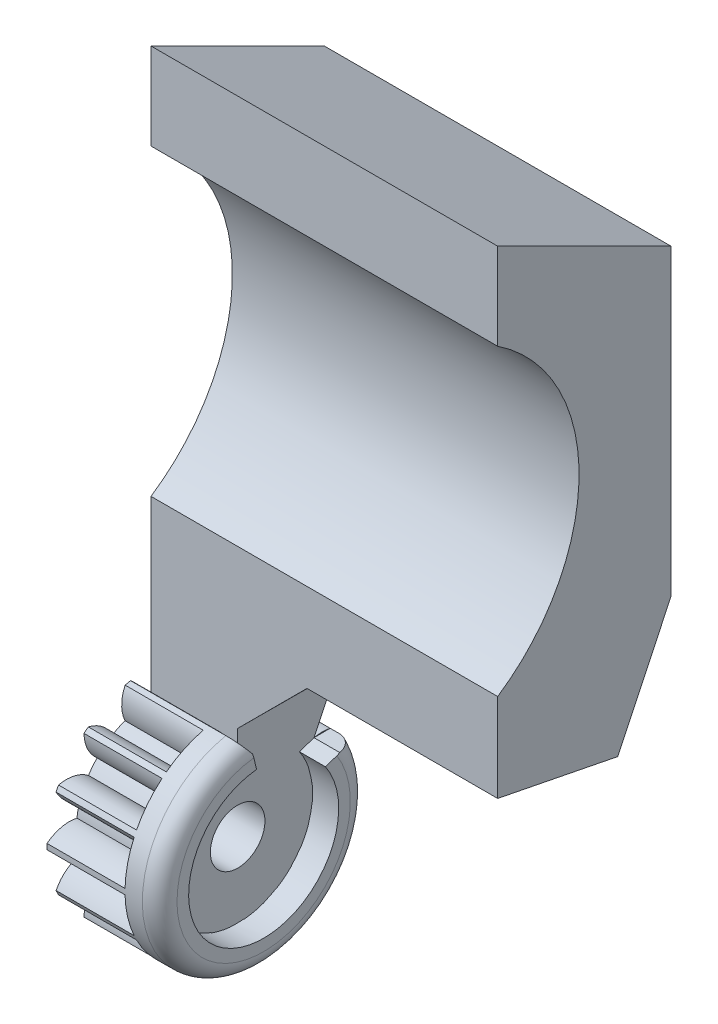
from build123d import *

# Parameters (mm, degrees)
BASPROSKE_W              = 10
BASPROSKE_H              = 12
TOOTHCUT_DEPTH           = 20.697716
TEETHCUTS_COUNT          = 14
TEETHCUTS_ANGLE          = 334.285714
BORSKE_R                 = 1.5
BORE_DEPTH               = 50.000051
BOSS_EXTRUDE1_DEPTH      = 10
BOSS_EXTRUDE2_START      = -40
BOSS_EXTRUDE2_DEPTH      = 40
CUT_EXTRUDE5_DEPTH       = 30
BOSS_EXTRUDE5_DEPTH      = 10
CHAMFER1_SIZE            = 10
BOSS_EXTRUDE6_DEPTH      = 3
BOSS_EXTRUDE6_DEPTH_BACK = 1
FILLET1_R                = 2
SKETCH12_R               = 3.15
CUT_EXTRUDE6_DEPTH       = 87.463865


with BuildPart() as part:
    # BasProSke → Base-Revolve (revolve)
    with BuildSketch(Plane(origin=(0, 0, 0), x_dir=(1, 0, 0), z_dir=(0, 1, 0)), mode=Mode.PRIVATE) as base_revolve_sk:
        with Locations((5, 6)):
            Rectangle(BASPROSKE_W, BASPROSKE_H)
    revolve(base_revolve_sk.sketch.rotate(Axis((-10, 0, 0), (1, 0, 0)), 180), axis=Axis((-10, 0, 0), (1, 0, 0)))

    # TooCutSke → ToothCut (cut, through all)
    with BuildSketch(Plane(origin=(0, 0, 0), x_dir=(0, 0, -1), z_dir=(1, 0, 0))):
        with BuildLine():
            ThreePointArc((0.804846, 8.586361), (0, 8.624), (-0.804846, 8.586361))
            ThreePointArc((-0.804846, 8.586361), (-1.237812, 10.362618), (-2.384428, 11.786634))
            ThreePointArc((-2.384428, 11.786634), (0, 12.0254), (2.384428, 11.786634))
            ThreePointArc((2.384428, 11.786634), (1.237812, 10.362618), (0.804846, 8.586361))
        make_face()
    toothcut = extrude(amount=TOOTHCUT_DEPTH, mode=Mode.SUBTRACT)

    # TeethCuts: ToothCut ×14 about axis
    teethcuts_axis = Axis((-10, 0, 0), (1, 0, 0))
    for i in range(1, TEETHCUTS_COUNT):
        add(toothcut.rotate(teethcuts_axis, i * TEETHCUTS_ANGLE / (TEETHCUTS_COUNT - 1)), mode=Mode.SUBTRACT)

    # BorSke → Bore (cut, symmetric)
    with BuildSketch(Plane(origin=(0, 0, 0), x_dir=(0, 0, -1), z_dir=(1, 0, 0))):
        with Locations(Location((0, 0, 0), (0, 0, 180))):
            Circle(BORSKE_R)
    extrude(amount=BORE_DEPTH, both=True, mode=Mode.SUBTRACT)

    # Sketch1 → Boss-Extrude1 (add)
    with BuildSketch(Plane(origin=(10, 0, 0), x_dir=(0, 0, -1), z_dir=(1, 0, 0))):
        with BuildLine():
            Line((0, 29), (0, 4))
            Line((0, 4), (8, 4))
            Line((8, 4), (20, 29))
            Line((20, 29), (20, 64))
            Line((20, 64), (0, 74))
            Line((0, 74), (0, 64))
            ThreePointArc((0, 64), (9.391813, 46.5), (0, 29))
        make_face()
    extrude(amount=-BOSS_EXTRUDE1_DEPTH)

    # Sketch2 → Boss-Extrude2 (add)
    with BuildSketch(Plane.ZY.offset(BOSS_EXTRUDE2_START)):
        with BuildLine():
            Line((-20, 29), (-7.698792, 3.139406))
            Line((-7.698792, 3.139406), (0, 8.624))
            Line((0, 8.624), (0, 29))
            ThreePointArc((0, 29), (-9.391813, 46.5), (0, 64))
            Line((0, 64), (0, 74))
            Line((0, 74), (-20, 64))
            Line((-20, 64), (-20, 29))
        make_face()
    extrude(amount=BOSS_EXTRUDE2_DEPTH)

    # Sketch9 → Cut-Extrude5 (cut)
    with BuildSketch(Plane(origin=(40, 0, 0), x_dir=(0, 0, -1), z_dir=(1, 0, 0))):
        Polygon((7.698792, 3.139406), (0, 8.624), (0, 18.812), (13.849396, 16.069703), align=None)
    extrude(amount=-CUT_EXTRUDE5_DEPTH, mode=Mode.SUBTRACT)

    # Sketch10 → Boss-Extrude5 (add)
    with BuildSketch(Plane(origin=(10, 0, 0), x_dir=(0, 0, -1), z_dir=(1, 0, 0))):
        Polygon((0, 18.812), (0, 10.812), (11.330599, 10.774484), (15.153835, 18.812), align=None)
    extrude(amount=BOSS_EXTRUDE5_DEPTH)

    # Chamfer1
    # the kernel refuses this chamfer: 10 mm, written as the material it takes off along each edge
    with BuildSketch(Plane(origin=(20, 10.897149, 25.716689), x_dir=(0.027495876610586313, 0.9996164375424699, -0.003309768015556128), z_dir=(0, -0.0033110198561701067, -0.999994518558733))) as chamfer1_piece_1_section:
        Polygon((CHAMFER1_SIZE * 0.999621916911, -CHAMFER1_SIZE * 0.0274958766106), (-CHAMFER1_SIZE * 0.0274958766106, -CHAMFER1_SIZE * 0.999621916911), (0, 0), align=None)
    chamfer1_piece_1 = extrude(amount=62.764321, mode=Mode.PRIVATE)
    chamfer1_piece_1 = split(chamfer1_piece_1, bisect_by=Plane(origin=(16.383831, 18.515288, -1.498481), z_dir=(0, -0.980954576947178, 0.19423727234077168)), keep=Keep.TOP, mode=Mode.PRIVATE)
    chamfer1_piece_1 = split(chamfer1_piece_1, bisect_by=Plane(origin=(10, 13.486301, -0.502699), z_dir=(1, 0, 0)), keep=Keep.TOP, mode=Mode.PRIVATE)
    add(chamfer1_piece_1, mode=Mode.SUBTRACT)

    # Sketch11 → Boss-Extrude6 (add, two sides: drawn at the far end of the back side and taken through both)
    with BuildSketch(Plane(origin=(10, 0, 0), x_dir=(0, 0, -1), z_dir=(1, 0, 0)).offset(-BOSS_EXTRUDE6_DEPTH_BACK)):
        with BuildLine():
            Line((-2.358667, 11.765912), (-1.230525, 10.347781))
            Line((-1.230525, 10.347781), (-0.81596, 8.618917))
            ThreePointArc((-0.81596, 8.618917), (-3.657356, -7.846992), (7.125155, 4.917692))
            Line((7.125155, 4.917692), (8.811802, 5.479265))
            Line((8.811802, 5.479265), (10.669566, 5.491846))
            ThreePointArc((10.669566, 5.491846), (-5.206605, -10.811626), (-2.358667, 11.765912))
        make_face()
    extrude(amount=BOSS_EXTRUDE6_DEPTH + BOSS_EXTRUDE6_DEPTH_BACK)

    # Fillet1
    fillet1_edges = [part.edges().sort_by_distance(p)[0] for p in [
        (13, -10.811626, 5.206605),
    ]]
    fillet(fillet1_edges, radius=FILLET1_R)

    # Sketch12 → Cut-Extrude6 (cut, through all)
    with BuildSketch(Plane.ZY):
        Circle(SKETCH12_R)
    extrude(amount=-CUT_EXTRUDE6_DEPTH, mode=Mode.SUBTRACT)


solid = part.part
